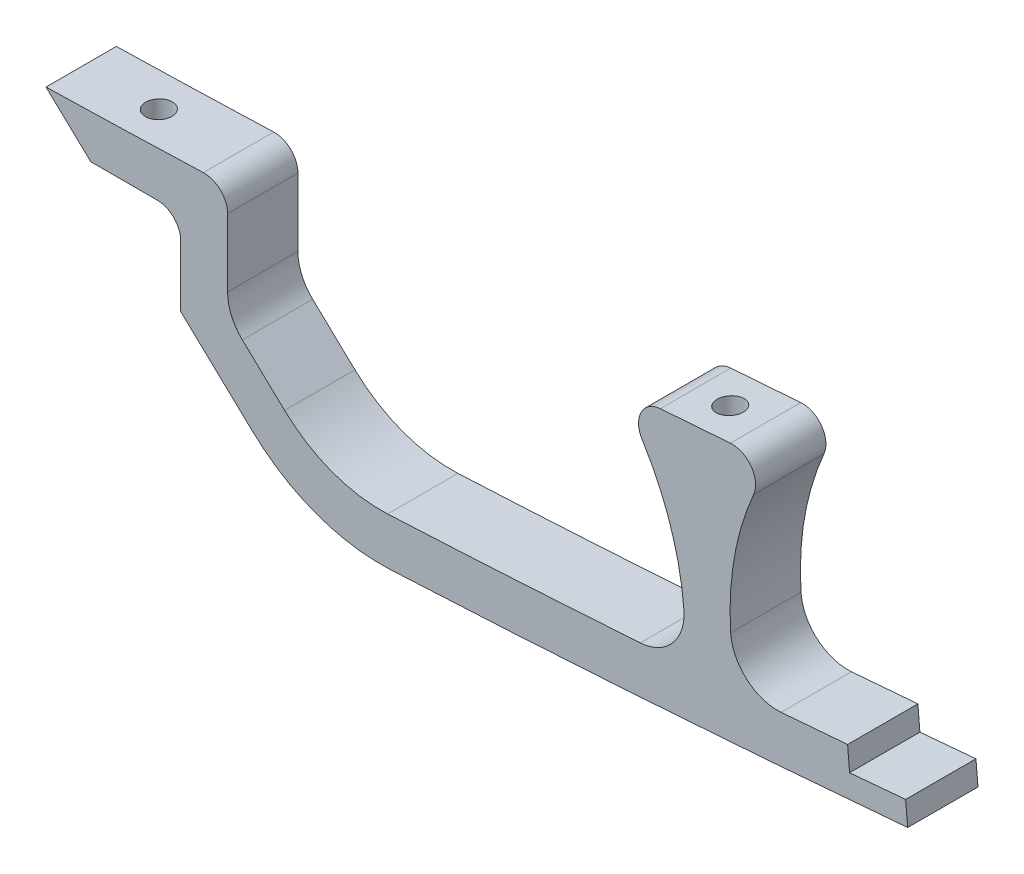
from build123d import *

# Parameters (mm, degrees)
BOSS_EXTRUDE1_START     = -4.7625
BOSS_EXTRUDE1_DEPTH     = 9.525
SKETCH4_R               = 3.175
CUT_EXTRUDE1_DEPTH      = 3.556
SKETCH5_R               = 1.778
CUT_EXTRUDE2_DEPTH      = 3.556
SKETCH6_R               = 1.778
CUT_EXTRUDE3_DEPTH      = 389.542033304
CUT_EXTRUDE4_DEPTH      = 3.556
CUT_EXTRUDE4_DEPTH_BACK = 388.321146479
SKETCH7_R               = 3.175
SKETCH7_R_2             = 1.778


# Read off the part's stored shape, not the designer's step: Boss-Extrude1
with BuildPart() as part:
    # Boss-Extrude1 outline → Boss-Extrude1 (new body)
    with BuildSketch(Plane(origin=(-0.151105159, 1.836314253, 0), x_dir=(-0.9999999911893379, -0.00013274533532885028, 0), z_dir=(0, 0, -1)).offset(BOSS_EXTRUDE1_START)):
        with BuildLine():
            add(Edge.make_bspline(
                [(266.719101765, -62.051598198), (285.372886056, -63.687772151), (308.740732669, -65.369335536), (332.113756278, -66.591725825), (336.786834388, -66.817774574)],
                knots=[0, 0, 0, 0, 0.444589519, 0.555671616, 0.555671616, 0.555671616, 0.555671616], degree=3))
            ThreePointArc((336.786834388, -66.817774574), (346.821832777, -65.271443631), (355.449407296, -59.918193219))
            Line((355.449407296, -59.918193219), (365.162167793, -50.749897782))
            Line((365.162167793, -50.749897782), (365.162167793, -42.440188824))
            ThreePointArc((365.162167793, -42.440188824), (366.092103763, -40.195124794), (368.337167793, -39.265188824))
            Line((368.337167793, -39.265188824), (377.328903503, -39.265188824))
            Line((377.328903503, -39.265188824), (383.403102119, -33.531489588))
            add(Edge.make_bspline(
                [(362.097911235, -32.917120768), (369.197743206, -33.164912437), (376.299473684, -33.369697882), (383.403102119, -33.531489588)],
                knots=[0.746516847, 0.746516847, 0.746516847, 0.746516847, 0.918535276, 0.918535276, 0.918535276, 0.918535276], degree=3))
            ThreePointArc((362.097911235, -32.917120768), (359.781604988, -33.806306666), (358.812167793, -36.090188824))
            Line((358.812167793, -36.090188824), (358.812167793, -45.273612359))
            ThreePointArc((358.812167793, -45.273612359), (358.293167277, -47.787960192), (356.821004007, -49.891300836))
            Line((356.821004007, -49.891300836), (351.090571083, -55.300504742))
            ThreePointArc((351.090571083, -55.300504742), (344.645600305, -59.305916448), (337.148417456, -60.4777614))
            add(Edge.make_bspline(
                [(302.92001028, -58.493795672), (304.509330321, -58.60122978), (315.913868956, -59.356827875), (327.324554644, -60.002877801), (337.148417456, -60.4777614)],
                knots=[0.283817359, 0.283817359, 0.283817359, 0.283817359, 0.321763123, 0.556088201, 0.556088201, 0.556088201, 0.556088201], degree=3))
            ThreePointArc((302.92001028, -58.493795672), (298.540134178, -56.306049329), (297.01844307, -51.652662937))
            ThreePointArc((297.01844307, -51.652662937), (298.817944258, -42.742557946), (302.676848033, -34.512306606))
            ThreePointArc((302.676848033, -34.512306606), (302.812285866, -31.389489502), (300.205974442, -29.663954561))
            add(Edge.make_bspline(
                [(290.723349608, -28.971987248), (293.88384664, -29.211203734), (297.044721601, -29.441859136), (300.205974442, -29.663954561)],
                knots=[0.169565869, 0.169565869, 0.169565869, 0.169565869, 0.246277706, 0.246277706, 0.246277706, 0.246277706], degree=3))
            ThreePointArc((290.723349608, -28.971987248), (287.894150829, -30.300881632), (287.574810624, -33.410278334))
            ThreePointArc((287.574810624, -33.410278334), (290.198038966, -42.113548005), (290.684983891, -51.190503181))
            ThreePointArc((290.684983891, -51.190503181), (288.503875799, -55.573685628), (283.852803221, -57.102425178))
            add(Edge.make_bspline(
                [(274.852701957, -56.374410111), (275.484326416, -56.427106964), (276.92498218, -56.546530571), (279.175001885, -56.730301658), (281.5434013, -56.92049496), (283.102708442, -57.04365577), (283.852803221, -57.102425178)],
                knots=[0.060364421, 0.060364421, 0.060364421, 0.060364421, 0.075455527, 0.094786271, 0.114117015, 0.132034547, 0.132034547, 0.132034547, 0.132034547], degree=3))
            Line((274.852701957, -56.374410111), (274.587380233, -59.554556157))
            Line((274.587380233, -59.554556157), (266.996524483, -58.888741635))
            Line((266.996524483, -58.888741635), (266.719101765, -62.051598198))
        make_face()
    extrude(amount=BOSS_EXTRUDE1_DEPTH)

    # Sketch4 → Cut-Extrude1 (cut)
    with BuildSketch(Plane(origin=(0.004968506, -37.428854199, 0), x_dir=(-0.999999991182225, -0.00013274533532793586, -3.771739900033909e-06), z_dir=(0.00013274533532888006, -0.999999991189338, 0))):
        with Locations(Location((373.034764896, -0.001423755, 0), (0, 0, 179.999783895))):
            Circle(SKETCH4_R)
    extrude(amount=-CUT_EXTRUDE1_DEPTH, mode=Mode.SUBTRACT)

    # Sketch5 → Cut-Extrude2 (cut)
    with BuildSketch(Plane(origin=(0.004496463, -33.872854231, 0), x_dir=(-0.999999991182225, -0.00013274533532793586, -3.771739900033909e-06), z_dir=(0.00013274533532888006, -0.9999999911893379, 0))):
        with Locations(Location((373.034764896, -0.001423755, 0), (0, 0, 179.999783895))):
            Circle(SKETCH5_R)
    extrude(amount=-CUT_EXTRUDE2_DEPTH, mode=Mode.SUBTRACT)

    # Sketch6 → Cut-Extrude3 (cut, through all)
    with BuildSketch(Plane(origin=(0.429757188, -5.878582453, 0), x_dir=(0.9973298035047504, 0.0729103752016881, 0.004164160074363476), z_dir=(-0.07291100735121511, 0.9973384505808602, 0))):
        with Locations(Location((-296.848920319, -1.255850637, 0), (0, 0, 180.238589487))):
            Circle(SKETCH6_R)
    extrude(amount=-CUT_EXTRUDE3_DEPTH, mode=Mode.SUBTRACT)

    # Sketch7 → Cut-Extrude4 (cut, two sides: drawn at the far end of the back side and taken through both)
    with BuildSketch(Plane(origin=(2.97617412, -40.71062784, 0), x_dir=(0.9973298035047504, 0.0729103752016881, 0.004164160074363476), z_dir=(-0.07291100735121511, 0.9973384505808603, 0)).offset(-CUT_EXTRUDE4_DEPTH_BACK)):
        with Locations(Location((-296.848920319, -1.255850637, 0), (0, 0, 180.238589487))):
            Circle(SKETCH7_R)
        with Locations(Location((-296.848920319, -1.255850637, 0), (0, 0, 180.238589487))):
            Circle(SKETCH7_R_2, mode=Mode.SUBTRACT)
    extrude(amount=CUT_EXTRUDE4_DEPTH + CUT_EXTRUDE4_DEPTH_BACK, mode=Mode.SUBTRACT)


solid = part.part
